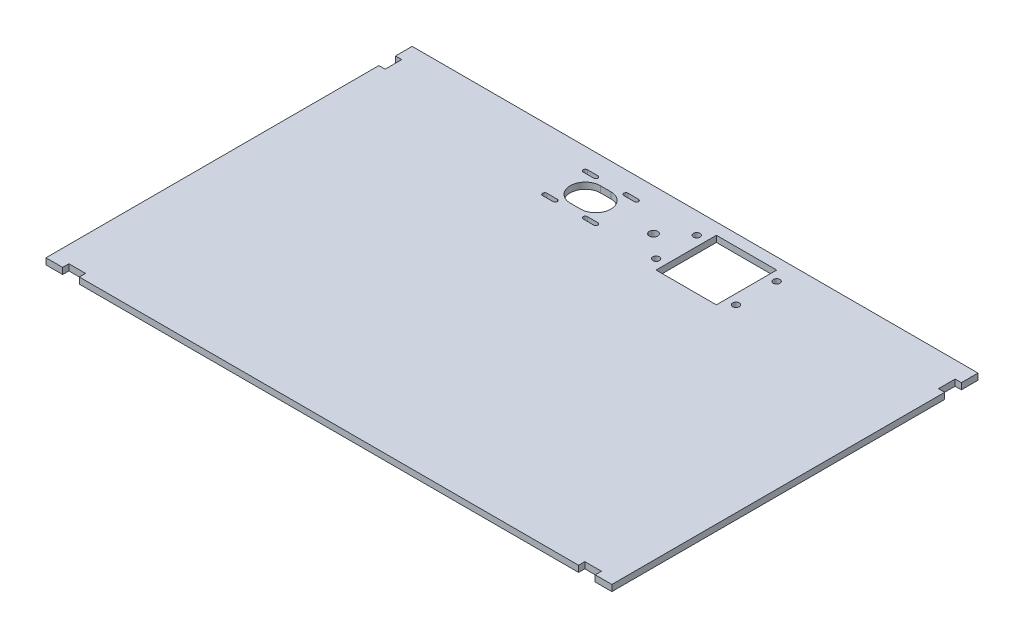
from build123d import *

# Parameters (mm, degrees)
SKETCH1_R           = 3.175
BOSS_EXTRUDE1_DEPTH = 4.7625
SKETCH5_R           = 2.54
SKETCH5_W           = 46
SKETCH5_H           = 46
CUT_EXTRUDE2_DEPTH  = 515.332850794


with BuildPart() as part:
    # Sketch1 → Boss-Extrude1 (new body)
    with BuildSketch(Plane(origin=(0, 0, 0), x_dir=(1, 0, 0), z_dir=(0, 1, 0))):
        Polygon((0, 0), (12.7, 0), (12.7, 4.7625), (25.4, 4.7625), (25.4, 0), (406.4, 0), (406.4, 4.7625), (419.1, 4.7625), (419.1, 0), (431.8, 0), (431.8, 254), (427.0375, 254), (427.0375, 266.7), (431.8, 266.7), (431.8, 279.4), (0, 279.4), (0, 266.7), (4.7625, 266.7), (4.7625, 254), (0, 254), align=None)
        with Locations((215.9, 247.65)):
            Circle(SKETCH1_R, mode=Mode.SUBTRACT)
        with BuildLine():
            Line((148.394, 264.75), (156.394, 264.75))
            ThreePointArc((156.394, 264.75), (157.994, 263.15), (156.394, 261.55))
            Line((156.394, 261.55), (148.394, 261.55))
            ThreePointArc((148.394, 261.55), (146.794, 263.15), (148.394, 264.75))
        make_face(mode=Mode.SUBTRACT)
        with BuildLine():
            Line((179.394, 264.75), (187.394, 264.75))
            ThreePointArc((187.394, 264.75), (188.994, 263.15), (187.394, 261.55))
            Line((187.394, 261.55), (179.394, 261.55))
            ThreePointArc((179.394, 261.55), (177.794, 263.15), (179.394, 264.75))
        make_face(mode=Mode.SUBTRACT)
        with BuildLine():
            Line((148.394, 233.75), (156.394, 233.75))
            ThreePointArc((156.394, 233.75), (157.994, 232.15), (156.394, 230.55))
            Line((156.394, 230.55), (148.394, 230.55))
            ThreePointArc((148.394, 230.55), (146.794, 232.15), (148.394, 233.75))
        make_face(mode=Mode.SUBTRACT)
        with BuildLine():
            Line((179.394, 233.75), (187.394, 233.75))
            ThreePointArc((187.394, 233.75), (188.994, 232.15), (187.394, 230.55))
            Line((187.394, 230.55), (179.394, 230.55))
            ThreePointArc((179.394, 230.55), (177.794, 232.15), (179.394, 233.75))
        make_face(mode=Mode.SUBTRACT)
        with BuildLine():
            Line((244.406, 264.75), (252.406, 264.75))
            ThreePointArc((252.406, 264.75), (254.006, 263.15), (252.406, 261.55))
            Line((252.406, 261.55), (244.406, 261.55))
            ThreePointArc((244.406, 261.55), (242.806, 263.15), (244.406, 264.75))
        make_face(mode=Mode.SUBTRACT)
        with BuildLine():
            Line((244.406, 233.75), (252.406, 233.75))
            ThreePointArc((252.406, 233.75), (254.006, 232.15), (252.406, 230.55))
            Line((252.406, 230.55), (244.406, 230.55))
            ThreePointArc((244.406, 230.55), (242.806, 232.15), (244.406, 233.75))
        make_face(mode=Mode.SUBTRACT)
        with BuildLine():
            Line((275.406, 233.75), (283.406, 233.75))
            ThreePointArc((283.406, 233.75), (285.006, 232.15), (283.406, 230.55))
            Line((283.406, 230.55), (275.406, 230.55))
            ThreePointArc((275.406, 230.55), (273.806, 232.15), (275.406, 233.75))
        make_face(mode=Mode.SUBTRACT)
        with BuildLine():
            Line((283.406, 261.55), (275.406, 261.55))
            ThreePointArc((275.406, 261.55), (273.806, 263.15), (275.406, 264.75))
            Line((275.406, 264.75), (283.406, 264.75))
            ThreePointArc((283.406, 264.75), (285.006, 263.15), (283.406, 261.55))
        make_face(mode=Mode.SUBTRACT)
        with BuildLine():
            Line((163.894, 259.15), (171.894, 259.15))
            ThreePointArc((171.894, 259.15), (183.394, 247.65), (171.894, 236.15))
            Line((171.894, 236.15), (163.894, 236.15))
            ThreePointArc((163.894, 236.15), (152.394, 247.65), (163.894, 259.15))
        make_face(mode=Mode.SUBTRACT)
        with BuildLine():
            Line((259.906, 259.15), (267.906, 259.15))
            ThreePointArc((267.906, 259.15), (279.406, 247.65), (267.906, 236.15))
            Line((267.906, 236.15), (259.906, 236.15))
            ThreePointArc((259.906, 236.15), (248.406, 247.65), (259.906, 259.15))
        make_face(mode=Mode.SUBTRACT)
    extrude(amount=BOSS_EXTRUDE1_DEPTH)

    # Sketch5 → Cut-Extrude2 (cut, through all)
    with BuildSketch(Plane(origin=(0, 4.7625, 0), x_dir=(1, 0, 0), z_dir=(0, 1, 0))):
        with Locations((233.426, 263.15)):
            Circle(SKETCH5_R)
        with Locations((294.386, 263.15)):
            Circle(SKETCH5_R)
        with Locations((233.426, 232.15)):
            Circle(SKETCH5_R)
        with Locations((294.386, 232.15)):
            Circle(SKETCH5_R)
        with Locations((263.906, 247.65)):
            Rectangle(SKETCH5_W, SKETCH5_H)
    extrude(amount=-CUT_EXTRUDE2_DEPTH, mode=Mode.SUBTRACT)


solid = part.part
